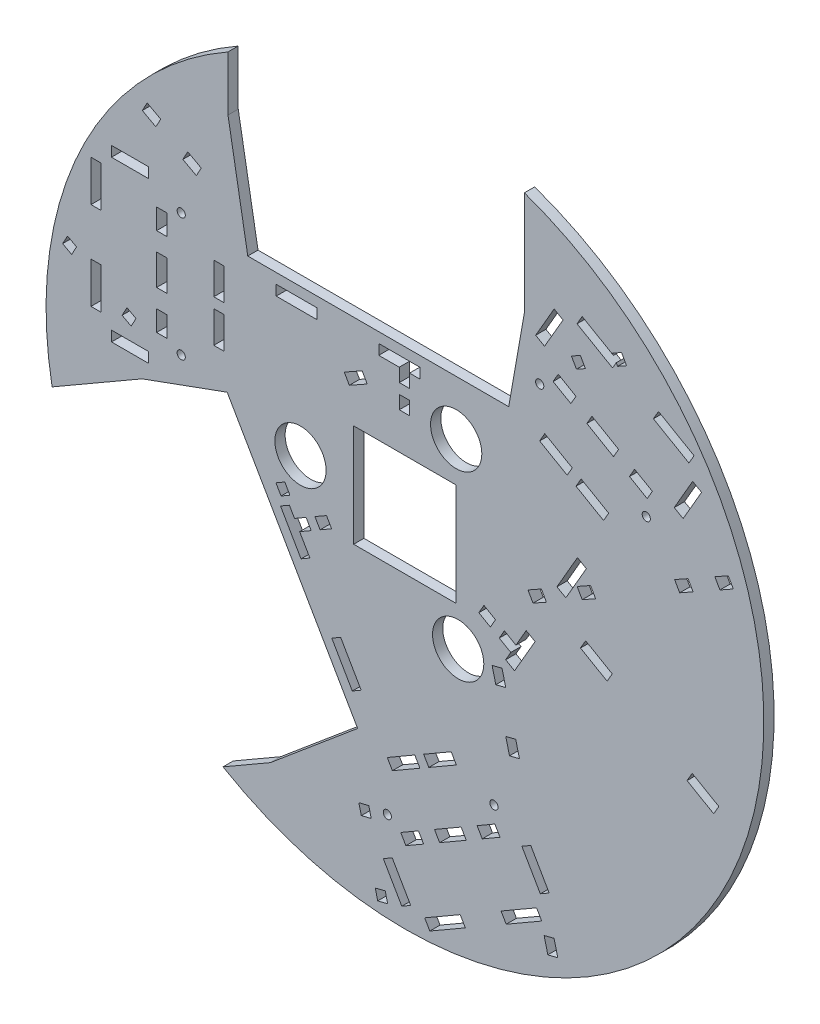
from build123d import *

# Parameters (mm, degrees)
ESQUISSE1_R                   = 175
BOSS_EXTRU_1_DEPTH            = 5
ESQUISSE2_W                   = 18
ESQUISSE2_H                   = 5
ESQUISSE2_W_2                 = 5
ESQUISSE2_H_2                 = 20
ESQUISSE2_H_3                 = 10
ESQUISSE2_H_4                 = 15
ESQUISSE2_H_5                 = 15.5
ESQUISSE2_W_3                 = 20
ESQUISSE2_H_6                 = 6.5
ENL_V_MAT_EXTRU_1_DEPTH       = 5
ESQUISSE6_R                   = 12.5
ESQUISSE6_W                   = 50
ESQUISSE6_H                   = 50
ENL_V_MAT_EXTRU_6_DEPTH       = 5
TROUS_DE_CENTRAGE_4_0MM1_D    = 4
HOLES_CATCHERS_OF_GLASS_DEPTH = 10
HOLES_BOARDS_SERVO_DEPTH      = 10


with BuildPart() as part:
    # Esquisse1 → Boss.-Extru.1 (new body)
    with BuildSketch(Plane.XY):
        with Locations((148.080426897, -12.110171348)):
            Circle(ESQUISSE1_R)
    extrude(amount=BOSS_EXTRU_1_DEPTH)

    # Esquisse2 → Enlèv. mat.-Extru.1 (cut)
    with BuildSketch(Plane.XY.offset(5)):
        Polygon((135.311788567, 53.777441362), (135.311788567, 48.777441362), (145.311788567, 48.777441362), (145.311788567, 42.277441362), (150.311788567, 42.277441362), (150.311788567, 48.777441362), (155.311788567, 48.777441362), (155.311788567, 53.777441362), align=None)
        with Locations((14, 69.777441362)):
            Rectangle(ESQUISSE2_W, ESQUISSE2_H)
        with Locations((-2.5, 52.277441362)):
            Rectangle(ESQUISSE2_W_2, ESQUISSE2_H_2)
        with Locations((-2.5, 9.277441362)):
            Rectangle(ESQUISSE2_W_2, ESQUISSE2_H_2)
        with Locations((14, -8.222558638)):
            Rectangle(ESQUISSE2_W, ESQUISSE2_H)
        with Locations((29.5, 9.277441362)):
            Rectangle(ESQUISSE2_W_2, ESQUISSE2_H_3)
        with Locations((29.5, 30.777441362)):
            Rectangle(ESQUISSE2_W_2, ESQUISSE2_H_4)
        with Locations((29.5, 52.277441362)):
            Rectangle(ESQUISSE2_W_2, ESQUISSE2_H_3)
        with Locations((57.36, 41.027441362)):
            Rectangle(ESQUISSE2_W_2, ESQUISSE2_H_5)
        with Locations((57.36, 20.527441362)):
            Rectangle(ESQUISSE2_W_2, ESQUISSE2_H_5)
        with Locations((95.311788567, 51.277441362)):
            Rectangle(ESQUISSE2_W_3, ESQUISSE2_H)
        with Locations((147.811788567, 34.027441362)):
            Rectangle(ESQUISSE2_W_2, ESQUISSE2_H_6)
        Polygon((292.702456717, 69.607306773), (283.702456717, 54.018849505), (279.372329698, 56.518849505), (288.372329698, 72.107306773), align=None)
        Polygon((289.042202679, 83.267560811), (286.542202679, 78.937433792), (269.221694603, 88.937433792), (271.721694603, 93.267560811), align=None)
        Polygon((251.803110316, 104.767560811), (249.303110316, 100.437433792), (231.982602241, 110.437433792), (234.482602241, 114.767560811), align=None)
        Polygon((225.152475222, 108.607306773), (216.152475222, 93.018849505), (211.822348203, 95.518849505), (220.822348203, 111.107306773), align=None)
        Polygon((231.472983297, 79.55474789), (228.972983297, 75.224620871), (220.31272926, 80.224620871), (222.81272926, 84.55474789), align=None)
        Polygon((252.257592988, 67.55474789), (249.757592988, 63.224620871), (236.767211932, 70.724620871), (239.267211932, 75.05474789), align=None)
        Polygon((268.71207566, 58.05474789), (266.21207566, 53.724620871), (257.551821622, 58.724620871), (260.051821622, 63.05474789), align=None)
        Polygon((247.420859728, 38.17728014), (244.920859728, 33.847153121), (231.497465969, 41.597153121), (233.997465969, 45.92728014), align=None)
        Polygon((229.66733895, 48.42728014), (227.16733895, 44.097153121), (213.743945192, 51.847153121), (216.243945192, 56.17728014), align=None)
        Polygon((211.525092463, -33.996012539), (207.194965444, -31.496012539), (202.194965444, -40.156266577), (196.56580032, -36.906266577), (194.06580032, -41.236393596), (199.694965444, -44.486393596), (197.194965444, -48.816520615), (201.525092463, -51.316520615), align=None)
        Polygon((236.525092463, 9.30525765), (226.525092463, -8.015250425), (222.194965444, -5.515250425), (232.194965444, 11.80525765), align=None)
        Polygon((192.235673301, -34.406266577), (189.735673301, -38.736393596), (184.106508176, -35.486393596), (186.606508176, -31.156266577), align=None)
        Polygon((146.538823973, -178.215262181), (137.538823973, -162.626804912), (141.868950992, -160.126804912), (150.868950992, -175.715262181), align=None)
        Polygon((160.199078011, -181.875516218), (157.699078011, -177.545389199), (175.019586086, -167.545389199), (177.519586086, -171.875516218), align=None)
        Polygon((197.438170373, -160.375516218), (194.938170373, -156.045389199), (212.258678449, -146.045389199), (214.758678449, -150.375516218), align=None)
        Polygon((214.088805468, -139.215262181), (205.088805468, -123.626804912), (209.418932487, -121.126804912), (218.418932487, -136.715262181), align=None)
        Polygon((185.768297392, -130.162703297), (183.268297392, -125.832576278), (191.92855143, -120.832576278), (194.42855143, -125.162703297), align=None)
        Polygon((164.983687701, -142.162703297), (162.483687701, -137.832576278), (175.474068758, -130.332576278), (177.974068758, -134.662703297), align=None)
        Polygon((148.52920503, -151.662703297), (146.02920503, -147.332576278), (154.689459067, -142.332576278), (157.189459067, -146.662703297), align=None)
        Polygon((141.960420962, -123.285235548), (139.460420962, -118.955108529), (152.88381472, -111.205108529), (155.38381472, -115.535235548), align=None)
        Polygon((159.713941739, -113.035235548), (157.213941739, -108.705108529), (170.637335498, -100.955108529), (173.137335498, -105.285235548), align=None)
        Polygon((97.404399659, -56.111942869), (101.734526678, -53.611942869), (96.734526678, -44.951688831), (102.363691803, -41.701688831), (99.863691803, -37.371561812), (94.234526678, -40.621561812), (91.734526678, -36.291434793), (87.404399659, -38.791434793), align=None)
        Polygon((122.404399659, -99.413213058), (112.404399659, -82.092704982), (116.734526678, -79.592704982), (126.734526678, -96.913213058), align=None)
        Polygon((106.693818822, -39.201688831), (104.193818822, -34.871561812), (109.822983946, -31.621561812), (112.322983946, -35.951688831), align=None)
    extrude(amount=-ENL_V_MAT_EXTRU_1_DEPTH, mode=Mode.SUBTRACT)

    # Esquisse6 → Enlèv. mat.-Extru.6 (cut)
    with BuildSketch(Plane.XY.offset(5)):
        with Locations((173.06, 32.277441362)):
            Circle(ESQUISSE6_R)
        with Locations((174.031440566, -55.936922587)):
            Circle(ESQUISSE6_R)
        with Locations((97.149840124, -12.67103282)):
            Circle(ESQUISSE6_R)
        Polygon((206.321253746, 102.221853729), (206.321253746, 185.563712918), (61.797190042, 185.563712918), (61.797190042, 113.486217733), (71.443823398, 58.777441362), (198.660831685, 58.777441362), align=None)
        with Locations((148.080426897, -12.110171348)):
            Rectangle(ESQUISSE6_W, ESQUISSE6_H)
        Polygon((19.945575289, -18.838148298), (-52.230591968, -60.509077893), (20.031439884, -185.670588519), (82.452381756, -149.631840926), (125.008255225, -113.923223194), (61.399751081, -3.750062223), align=None)
        Polygon((236.171367804, -21.307411432), (249.16174886, -28.807411432), (246.66174886, -33.137538451), (233.671367804, -25.637538451), align=None)
        Polygon((288.132892031, -51.307411432), (301.123273088, -58.807411432), (298.623273088, -63.137538451), (285.632892031, -55.637538451), align=None)
    extrude(amount=-ENL_V_MAT_EXTRU_6_DEPTH, mode=Mode.SUBTRACT)

    # Trous de centrage Ø4.0mm1 (through all)
    with Locations(Plane(origin=(148.080426897, -12.110171348, -78), x_dir=(1, 0, 0), z_dir=(0, 0, -1))):
        with Locations((65.70121345, -88.022614393), (117.662737677, -58.022614393), (-109.080426897, -72.887612711), (-109.080426897, -12.887612711), (-8.58231078, 130.910227103), (43.379213447, 100.910227103)):
            Hole(TROUS_DE_CENTRAGE_4_0MM1_D / 2)

    # Esquisse9 → Holes catchers of glass (cut)
    with BuildSketch(Plane.XY.offset(5)):
        Polygon((301.647255965, 32.874727734), (299.200467122, 37.235143352), (305.741090548, 40.905326617), (308.187879391, 36.544910999), align=None)
        Polygon((282.025385687, 21.864177939), (279.578596844, 26.224593557), (286.11922027, 29.894776822), (288.566009113, 25.534361204), align=None)
        Polygon((241.037478884, -1.135637188), (238.590690041, 3.22477843), (232.050066614, -0.445404835), (234.496855458, -4.805820453), align=None)
        Polygon((214.608404145, -10.232560209), (217.055192988, -14.592975826), (210.514569562, -18.263159091), (208.067780719, -13.902743474), align=None)
        Polygon((256.127471573, 104.799683271), (251.767055956, 102.352894427), (249.320267112, 106.713310045), (253.68068273, 109.160098888), align=None)
        Polygon((236.069559733, 93.544454591), (231.709144116, 91.097665748), (229.262355272, 95.458081365), (233.62277089, 97.904870209), align=None)
        Polygon((129.675418669, 33.842806814), (120.954587435, 28.949229127), (118.507798591, 33.309644745), (127.228629826, 38.203222431), align=None)
        Polygon((-16.43844555, 23.279140051), (-12.045948181, 20.890423478), (-14.434664754, 16.49792611), (-18.827162123, 18.886642683), align=None)
        Polygon((12.552037084, 7.51361067), (16.944534453, 5.124894098), (14.55581788, 0.732396729), (10.163320511, 3.121113302), align=None)
        Polygon((22.412737241, 98.907081949), (29.001483294, 95.32400709), (26.612766722, 90.931509721), (20.024020668, 94.514584581), align=None)
        Polygon((42.178975401, 88.157857372), (48.767721454, 84.574782512), (46.379004881, 80.182285143), (39.790258828, 83.765360003), align=None)
        Polygon((126.799616111, -149.834276272), (125.585690653, -144.983875775), (130.43609115, -143.769950316), (131.650016608, -148.620350813), align=None)
        Polygon((134.811524138, -181.846919552), (133.597598679, -176.996519055), (138.447999176, -175.782593596), (139.661924635, -180.632994093), align=None)
        Polygon((190.561972498, -54.501375823), (195.412372995, -53.287450364), (197.233261183, -60.56305111), (192.382860686, -61.776976568), align=None)
        Polygon((202.088963017, -79.964653097), (197.23856252, -81.178578556), (199.059450708, -88.454179302), (203.909851205, -87.240253843), align=None)
        Polygon((222.604303267, -161.936421496), (217.75390277, -163.150346955), (215.933014582, -155.874746209), (220.783415079, -154.660820751), align=None)
    extrude(amount=-HOLES_CATCHERS_OF_GLASS_DEPTH, mode=Mode.SUBTRACT)

    # Esquisse10 → Holes boards servo (cut)
    with BuildSketch(Plane.XY.offset(5)):
        Polygon((89.496120404, -27.614401399), (91.996120404, -31.944528418), (87.66720686, -34.443827818), (85.16720686, -30.113700799), align=None)
    extrude(amount=-HOLES_BOARDS_SERVO_DEPTH, mode=Mode.SUBTRACT)


solid = part.part
